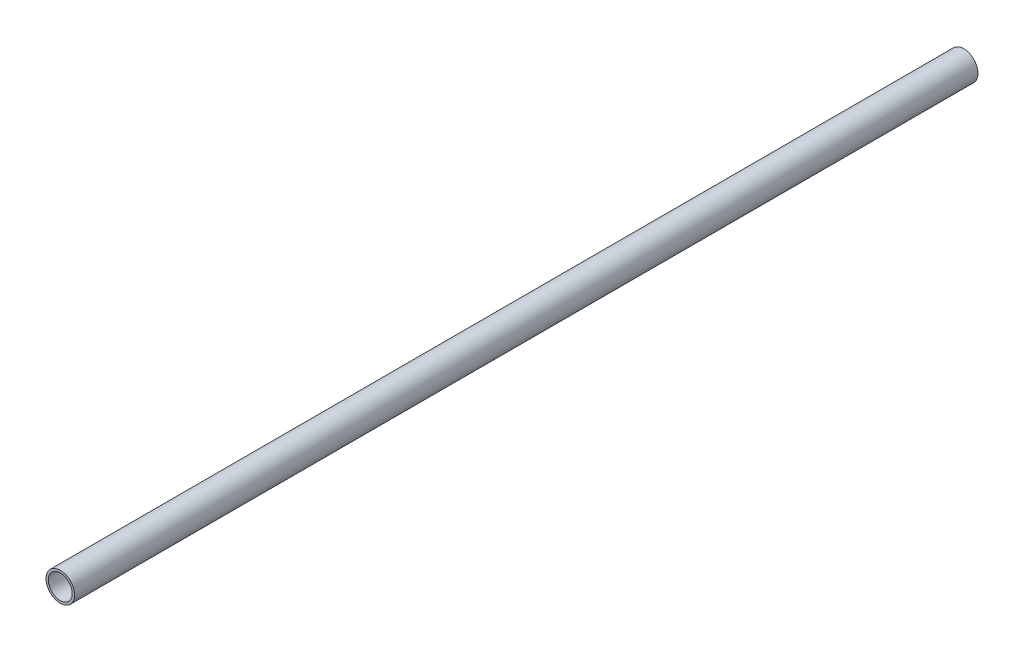
from build123d import *

# Parameters (mm, degrees)
SKETCH1_R           = 24.13
SKETCH1_R_2         = 20.193
BOSS_EXTRUDE1_DEPTH = 1524


with BuildPart() as part:
    # Sketch1 → Boss-Extrude1 (new body)
    with BuildSketch(Plane.XY):
        Circle(SKETCH1_R)
        Circle(SKETCH1_R_2, mode=Mode.SUBTRACT)
    extrude(amount=BOSS_EXTRUDE1_DEPTH)


solid = part.part
